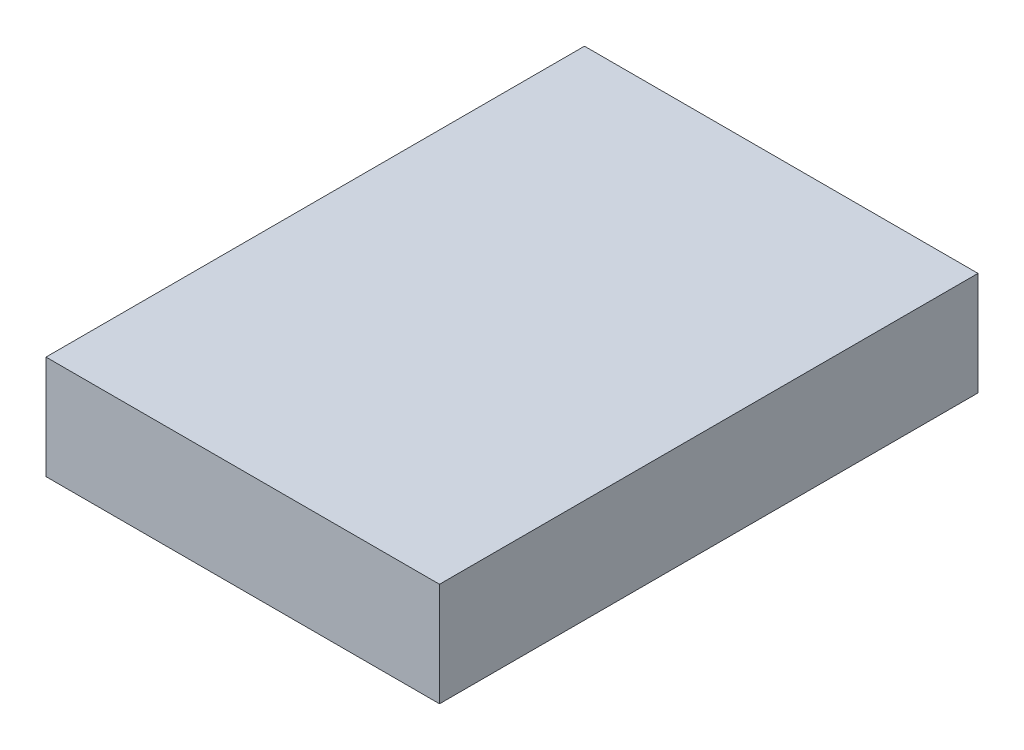
from build123d import *

# Parameters (mm, degrees)
SKETCH1_W           = 3.8
SKETCH1_H           = 5.2
BOSS_EXTRUDE1_DEPTH = 1


with BuildPart() as part:
    # Sketch1 → Boss-Extrude1 (new body)
    with BuildSketch(Plane(origin=(0, 0, 0), x_dir=(1, 0, 0), z_dir=(0, 1, 0))):
        Rectangle(SKETCH1_W, SKETCH1_H)
    extrude(amount=BOSS_EXTRUDE1_DEPTH)


solid = part.part
